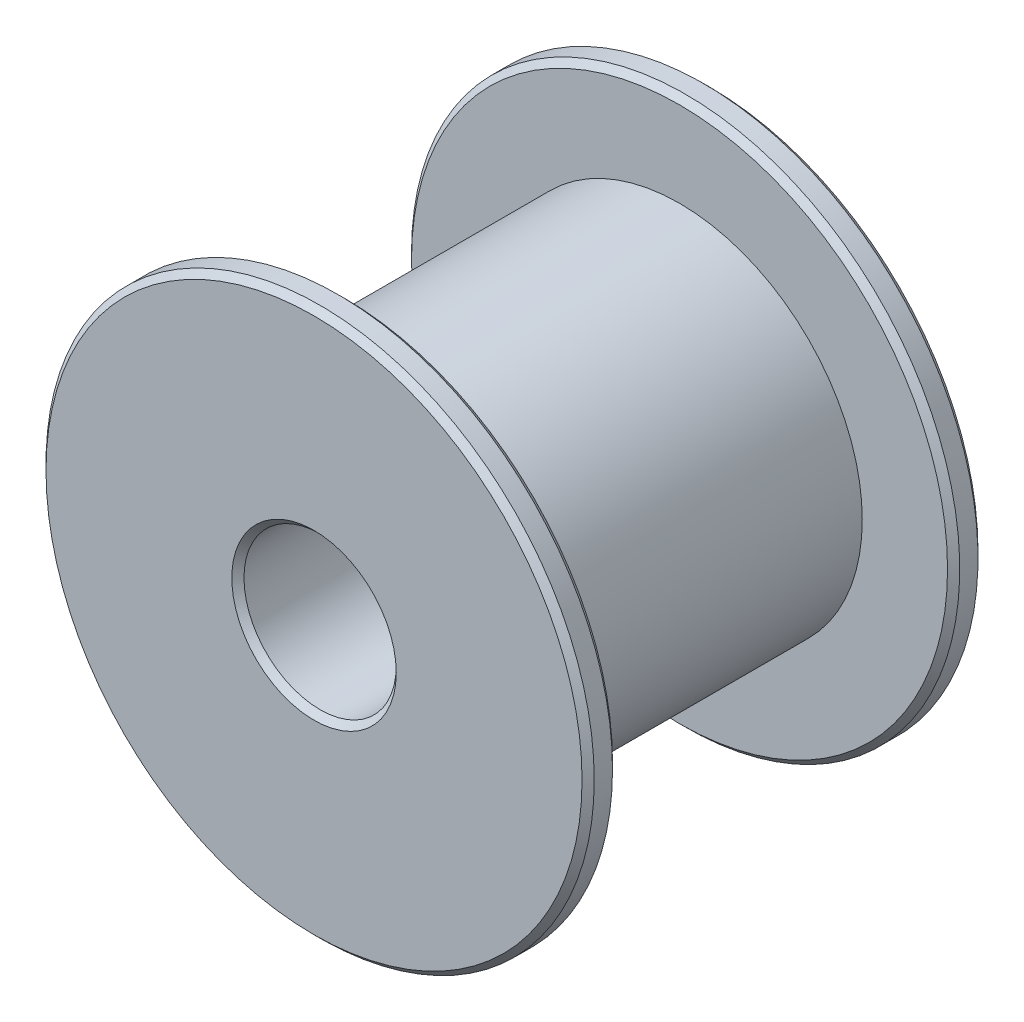
from build123d import *

# Parameters (mm, degrees)
SKIZZE1_R                       = 6
AUFSATZ_LINEAR_AUSTRAGEN1_DEPTH = 5.5
SKIZZE2_R                       = 9
AUFSATZ_LINEAR_AUSTRAGEN2_DEPTH = 1
SKIZZE3_R                       = 2.5
SCHNITT_LINEAR_AUSTRAGEN1_DEPTH = 19.193405399
FASE1_SIZE                      = 0.2


with BuildPart() as part:
    # Skizze1 → Aufsatz-Linear austragen1 (new, symmetric)
    with BuildSketch(Plane.XY):
        Circle(SKIZZE1_R)
    extrude(amount=AUFSATZ_LINEAR_AUSTRAGEN1_DEPTH, both=True)

    # Skizze2 → Aufsatz-Linear austragen2 (add)
    with BuildSketch(Plane.XY.offset(5.5)):
        Circle(SKIZZE2_R)
    aufsatz_linear_austragen2 = extrude(amount=AUFSATZ_LINEAR_AUSTRAGEN2_DEPTH)

    # Spiegeln1: Aufsatz-Linear austragen2 across plane
    add(aufsatz_linear_austragen2.mirror(Plane.XY))

    # Skizze3 → Schnitt-Linear austragen1 (cut, through all)
    with BuildSketch(Plane(origin=(0, 0, -6.5), x_dir=(-1, 0, 0), z_dir=(0, 0, -1))):
        Circle(SKIZZE3_R)
    extrude(amount=-SCHNITT_LINEAR_AUSTRAGEN1_DEPTH, mode=Mode.SUBTRACT)

    # Fase1
    fase1_edges = [part.edges().sort_by_distance(p)[0] for p in [
        (2.5, 0, -6.5),
        (2.5, 0, 6.5),
        (-9, 0, 6.5),
        (-9, 0, 5.5),
        (-9, 0, -5.5),
        (-9, 0, -6.5),
    ]]
    chamfer(fase1_edges, length=FASE1_SIZE)


solid = part.part
